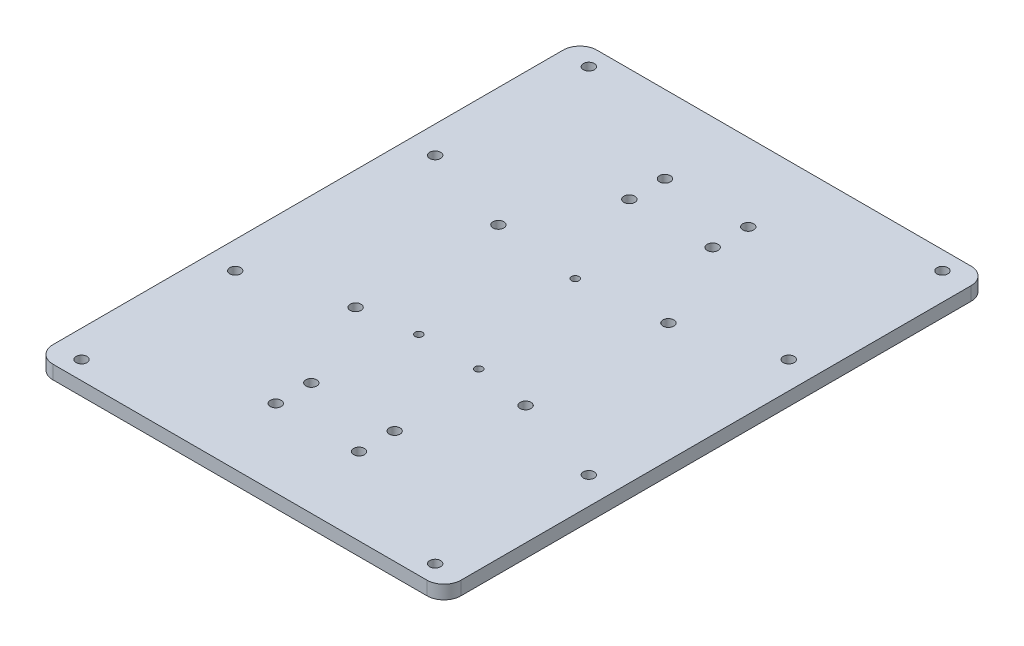
from build123d import *

# Parameters (mm, degrees)
SKETCH_1_W      = 120
SKETCH_1_H      = 160
SKETCH_1_R      = 1.6
SKETCH_1_R_2    = 1.1
EXTRUDE_1_DEPTH = 4
FILLET_1_R      = 5


with BuildPart() as part:
    # 草图1 → 凸台-拉伸1 (new body)
    with BuildSketch(Plane(origin=(0, 0, 0), x_dir=(1, 0, 0), z_dir=(0, 1, 0))):
        Rectangle(SKETCH_1_W, SKETCH_1_H)
        with Locations((-52, 74.6)):
            Circle(SKETCH_1_R, mode=Mode.SUBTRACT)
        with Locations((-52, 29.4)):
            Circle(SKETCH_1_R, mode=Mode.SUBTRACT)
        with Locations((-12.25, 57.23)):
            Circle(SKETCH_1_R, mode=Mode.SUBTRACT)
        with Locations((-12.25, 46.77)):
            Circle(SKETCH_1_R, mode=Mode.SUBTRACT)
        with Locations((-52, -29.4)):
            Circle(SKETCH_1_R, mode=Mode.SUBTRACT)
        with Locations((-12.25, -46.77)):
            Circle(SKETCH_1_R, mode=Mode.SUBTRACT)
        with Locations((-12.25, -57.23)):
            Circle(SKETCH_1_R, mode=Mode.SUBTRACT)
        with Locations((-52, -74.6)):
            Circle(SKETCH_1_R, mode=Mode.SUBTRACT)
        with Locations((52, -74.6)):
            Circle(SKETCH_1_R, mode=Mode.SUBTRACT)
        with Locations((12.25, -57.23)):
            Circle(SKETCH_1_R, mode=Mode.SUBTRACT)
        with Locations((12.25, -46.77)):
            Circle(SKETCH_1_R, mode=Mode.SUBTRACT)
        with Locations((52, -29.4)):
            Circle(SKETCH_1_R, mode=Mode.SUBTRACT)
        with Locations((52, 29.4)):
            Circle(SKETCH_1_R, mode=Mode.SUBTRACT)
        with Locations((12.25, 46.77)):
            Circle(SKETCH_1_R, mode=Mode.SUBTRACT)
        with Locations((12.25, 57.23)):
            Circle(SKETCH_1_R, mode=Mode.SUBTRACT)
        with Locations((52, 74.6)):
            Circle(SKETCH_1_R, mode=Mode.SUBTRACT)
        with Locations((0, 18.6)):
            Circle(SKETCH_1_R_2, mode=Mode.SUBTRACT)
        with Locations((8.8, -18.6)):
            Circle(SKETCH_1_R_2, mode=Mode.SUBTRACT)
        with Locations((-8.8, -18.6)):
            Circle(SKETCH_1_R_2, mode=Mode.SUBTRACT)
        with Locations((-25, 21)):
            Circle(SKETCH_1_R, mode=Mode.SUBTRACT)
        with Locations((25, 21)):
            Circle(SKETCH_1_R, mode=Mode.SUBTRACT)
        with Locations((25, -21)):
            Circle(SKETCH_1_R, mode=Mode.SUBTRACT)
        with Locations((-25, -21)):
            Circle(SKETCH_1_R, mode=Mode.SUBTRACT)
    extrude(amount=EXTRUDE_1_DEPTH)

    # 圆角1
    fillet_1_edges = [part.edges().sort_by_distance(p)[0] for p in [
        (-60, 2, -80),
        (60, 2, -80),
        (60, 2, 80),
        (-60, 2, 80),
    ]]
    fillet(fillet_1_edges, radius=FILLET_1_R)


solid = part.part
